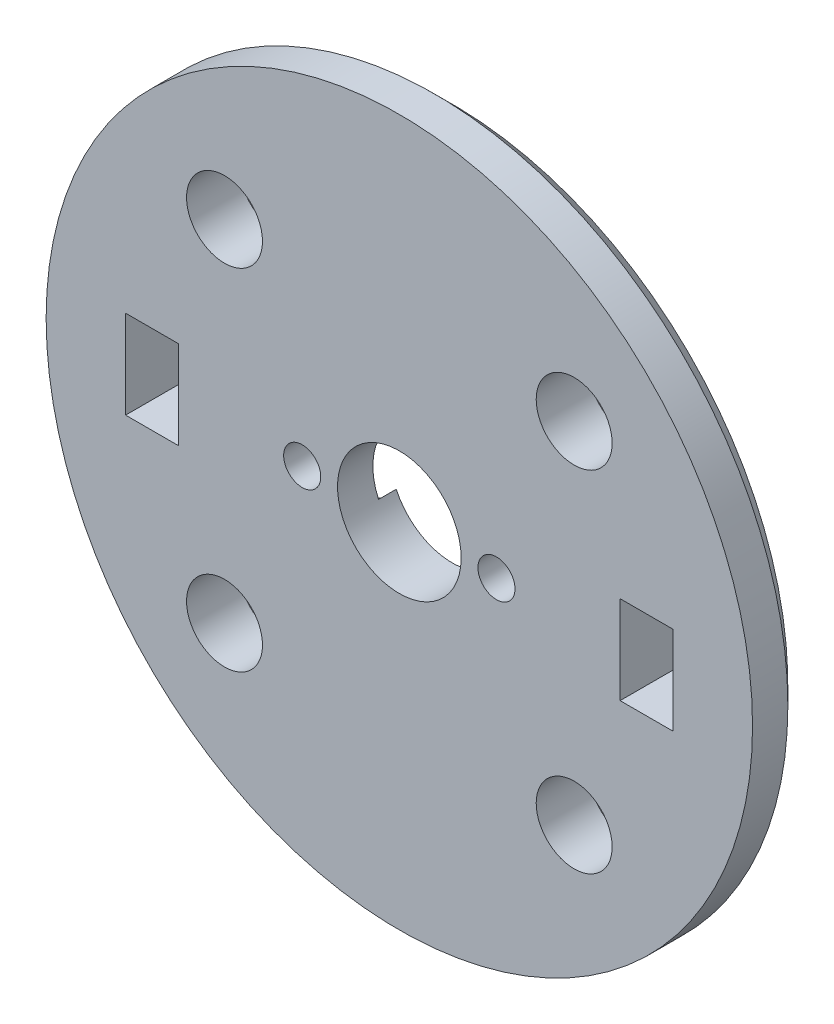
from build123d import *

# Parameters (mm, degrees)
SKETCH_1_R               = 20
EXTRUDE_1_DEPTH          = 2
SKETCH_2_R               = 3.5
CUT_EXTRUDE_1_DEPTH      = 2
SKETCH_3_R               = 1.05
CUT_EXTRUDE_2_DEPTH      = 2
EXTRUDE_START            = 1
SKETCH_5_R               = 20
SKETCH_5_R_2             = 8.25
EXTRUDE_3_DEPTH          = 1
EXTRUDE_4_DEPTH          = 1
SKETCH_9_R               = 10.2
SKETCH_9_R_2             = 7
CUT_EXTRUDE_3_DEPTH      = 1.6
EXTRUDE_START_2          = 1.6
EXTRUDE_5_DEPTH          = 1.6
PATTERN_CIRCULAR_2_COUNT = 2
PATTERN_CIRCULAR_2_ANGLE = 180
SKETCH_13_R              = 2.75
CUT_EXTRUDE_4_DEPTH      = 1.6
FILLET_1_R               = 1.5
SKETCH_14_R              = 2.15
CUT_EXTRUDE_5_DEPTH      = 10
SKETCH_15_W              = 3
SKETCH_15_H              = 5
CUT_EXTRUDE_6_DEPTH      = 10
CHAMFER_1_SIZE           = 1


# Some blends are built 0.0001 mm under size
with BuildPart() as part:
    # 草图1 → 凸台-拉伸1 (new body)
    with BuildSketch(Plane.XY):
        Circle(SKETCH_1_R)
    extrude(amount=EXTRUDE_1_DEPTH)

    # 草图2 → 切除-拉伸1 (cut)
    with BuildSketch(Plane.XY.offset(2)):
        Circle(SKETCH_2_R)
    extrude(amount=-CUT_EXTRUDE_1_DEPTH, mode=Mode.SUBTRACT)

    # 草图3 → 切除-拉伸2 (cut)
    with BuildSketch(Plane.XY.offset(2)):
        with Locations((-5.5, 0)):
            Circle(SKETCH_3_R)
        with Locations((5.5, 0)):
            Circle(SKETCH_3_R)
    extrude(amount=-CUT_EXTRUDE_2_DEPTH, mode=Mode.SUBTRACT)

    # 草图5 → 凸台-拉伸3 (add)
    with BuildSketch(Plane(origin=(0, 0, 0), x_dir=(-1, 0, 0), z_dir=(0, 0, -1)).offset(EXTRUDE_START)):
        Circle(SKETCH_5_R)
        Circle(SKETCH_5_R_2, mode=Mode.SUBTRACT)
    extrude(amount=-EXTRUDE_3_DEPTH)

    # 草图8 → 凸台-拉伸4 (add)
    with BuildSketch(Plane(origin=(0, 0, 0), x_dir=(-1, 0, 0), z_dir=(0, 0, -1))):
        with BuildLine():
            ThreePointArc((3.176136364, 1.470427761), (6.265465545, 2.641318326), (8.25, 0))
            ThreePointArc((8.25, 0), (0, 8.25), (-8.25, 0))
            ThreePointArc((-8.25, 0), (-6.265465545, 2.641318326), (-3.176136364, 1.470427761))
            ThreePointArc((-3.176136364, 1.470427761), (0, 3.5), (3.176136364, 1.470427761))
        make_face()
        with BuildLine():
            ThreePointArc((-8.25, 0), (0, -8.25), (8.25, 0))
            ThreePointArc((8.25, 0), (6.265465545, -2.641318326), (3.176136364, -1.470427761))
            ThreePointArc((3.176136364, -1.470427761), (0, -3.5), (-3.176136364, -1.470427761))
            ThreePointArc((-3.176136364, -1.470427761), (-6.265465545, -2.641318326), (-8.25, 0))
        make_face()
    extrude(amount=EXTRUDE_4_DEPTH)

    # 草图9 → 切除-拉伸3 (cut)
    with BuildSketch(Plane(origin=(0, 0, -1), x_dir=(-1, 0, 0), z_dir=(0, 0, -1))):
        Circle(SKETCH_9_R)
        Circle(SKETCH_9_R_2, mode=Mode.SUBTRACT)
    extrude(amount=-CUT_EXTRUDE_3_DEPTH, mode=Mode.SUBTRACT)

    # 草图12 → 凸台-拉伸5 (add)
    with BuildSketch(Plane(origin=(0, 0, 0.6), x_dir=(-1, 0, 0), z_dir=(0, 0, -1)).offset(EXTRUDE_START_2)):
        with BuildLine():
            Line((6.344154509, 2.958327832), (9.244339428, 4.31070627))
            ThreePointArc((9.244339428, 4.31070627), (10.2, 0), (9.244339428, -4.31070627))
            Line((9.244339428, -4.31070627), (6.344154509, -2.958327832))
            ThreePointArc((6.344154509, -2.958327832), (7, 0), (6.344154509, 2.958327832))
        make_face()
    extrude_5 = extrude(amount=-EXTRUDE_5_DEPTH)

    # 阵列(圆周)2: 凸台-拉伸5 ×2 about axis
    pattern_circular_2_axis = Axis((0, 0, 0), (0, 0, 1))
    for i in range(1, PATTERN_CIRCULAR_2_COUNT):
        add(extrude_5.rotate(pattern_circular_2_axis, i * PATTERN_CIRCULAR_2_ANGLE / (PATTERN_CIRCULAR_2_COUNT - 1)))

    # 草图13 → 切除-拉伸4 (cut)
    with BuildSketch(Plane(origin=(0, 0, 0), x_dir=(-1, 0, 0), z_dir=(0, 0, -1))):
        with Locations((5.5, 0)):
            Circle(SKETCH_13_R)
        with Locations((-5.5, 0)):
            Circle(SKETCH_13_R)
    extrude(amount=CUT_EXTRUDE_4_DEPTH, mode=Mode.SUBTRACT)

    # 圆角1
    # the kernel refuses this fillet: 1.5 mm, written as the material it adds along each edge
    with BuildSketch(Plane(origin=(9.244339428, 4.31070627, -1), x_dir=(-0.49945721190303094, 0.8663385559225971, 0), z_dir=(0, 0, 1)), Plane(origin=(-9.244339428, -4.31070627, -1), x_dir=(0.49945721190302483, -0.8663385559226006, 0), z_dir=(0, 0, 1))) as fillet_1_piece_1:
        with BuildLine():
            CenterArc((1.635444705, 1.494373677), FILLET_1_R, 175.035904079, 99.928191842)
            Line((0.141071027, 1.624170876), (0, 0))
            ThreePointArc((0, 0), (0.882620952, -0.038258995), (1.765241903, 0))
        make_face()
    extrude(amount=1.6)
    with BuildSketch(Plane(origin=(9.244339428, -4.31070627, -1), x_dir=(-0.49945721190301884, -0.8663385559226039, 0), z_dir=(0, 0, 1)), Plane(origin=(-9.244339428, 4.31070627, -1), x_dir=(0.4994572119030254, 0.8663385559226003, 0), z_dir=(0, 0, 1))) as fillet_1_piece_2:
        with BuildLine():
            CenterArc((1.635444705, -1.494373677), FILLET_1_R, 85.035904079, 99.928191842)
            Line((0.141071027, -1.624170876), (0, 0))
            ThreePointArc((0, 0), (0.882620952, 0.038258995), (1.765241903, 0))
        make_face()
    extrude(amount=1.6)
    with BuildSketch(Plane(origin=(-6.344154509, 2.958327832, -1), x_dir=(-0.9063077870366493, 0.42261826174070083, 0), z_dir=(0, 0, 1)), Plane(origin=(6.344154509, -2.958327832, -1), x_dir=(0.9063077870366523, -0.4226182617406945, 0), z_dir=(0, 0, 1))) as fillet_1_piece_3:
        with BuildLine():
            CenterArc((1.366600265, -1.5), FILLET_1_R, 90, 79.835751378)
            ThreePointArc((-0.109858605, -1.235294118), (-0.027518743, -0.620084766), (0, 0))
            Line((0, 0), (1.366600265, 0))
        make_face()
    extrude(amount=1.6)
    with BuildSketch(Plane(origin=(-6.344154509, -2.958327832, -1), x_dir=(-0.9063077870366493, -0.4226182617407009, 0), z_dir=(0, 0, 1)), Plane(origin=(6.344154509, 2.958327832, -1), x_dir=(0.9063077870366462, 0.42261826174070743, 0), z_dir=(0, 0, 1))) as fillet_1_piece_4:
        with BuildLine():
            CenterArc((1.366600265, 1.5), FILLET_1_R, 190.164248622, 79.835751378)
            ThreePointArc((-0.109858605, 1.235294118), (-0.027518743, 0.620084766), (0, 0))
            Line((0, 0), (1.366600265, 0))
        make_face()
    extrude(amount=1.6)

    # 草图14 → 切除-拉伸5 (cut)
    with BuildSketch(Plane(origin=(0, 0, -1), x_dir=(-1, 0, 0), z_dir=(0, 0, -1))):
        with Locations((9.899494937, -9.899494937)):
            Circle(SKETCH_14_R)
        with Locations((-9.899494937, -9.899494937)):
            Circle(SKETCH_14_R)
        with Locations((-9.899494937, 9.899494937)):
            Circle(SKETCH_14_R)
        with Locations((9.899494937, 9.899494937)):
            Circle(SKETCH_14_R)
    extrude(amount=-CUT_EXTRUDE_5_DEPTH, mode=Mode.SUBTRACT)

    # 草图15 → 切除-拉伸6 (cut)
    with BuildSketch(Plane.XY.offset(2)):
        with Locations((-14, 0)):
            Rectangle(SKETCH_15_W, SKETCH_15_H)
        with Locations((14, 0)):
            Rectangle(SKETCH_15_W, SKETCH_15_H)
    extrude(amount=-CUT_EXTRUDE_6_DEPTH, mode=Mode.SUBTRACT)

    # 倒角1
    chamfer_1_edges = [part.edges().sort_by_distance(p)[0] for p in [
        (20, 0, -1),
    ]]
    chamfer(chamfer_1_edges, length=CHAMFER_1_SIZE - 0.0001)  # a hair under: the kernel refuses the full size


solid = part.part
